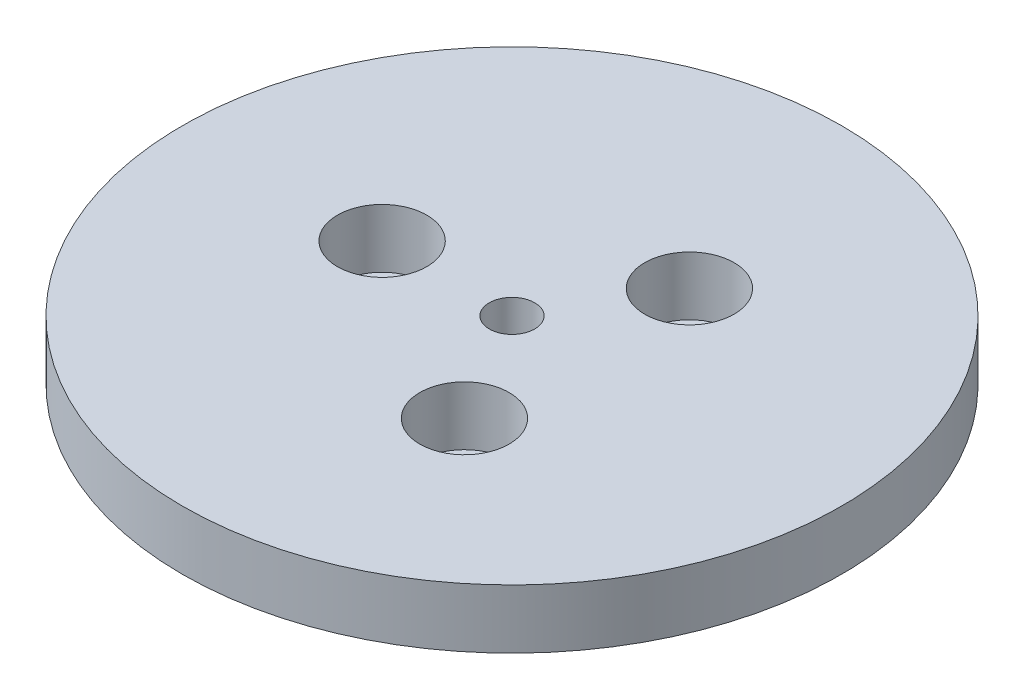
from build123d import *

# Parameters (mm, degrees)
SKETCH1_R           = 72.5
BOSS_EXTRUDE1_DEPTH = 13
SKETCH2_R           = 5
CUT_EXTRUDE1_DEPTH  = 104.351342517
SKETCH3_R           = 9.830839543
CUT_EXTRUDE2_DEPTH  = 12.925796005
CIRPATTERN1_COUNT   = 3


with BuildPart() as part:
    # Sketch1 → Boss-Extrude1 (new body)
    with BuildSketch(Plane(origin=(0, 0, 0), x_dir=(1, 0, 0), z_dir=(0, 1, 0))):
        Circle(SKETCH1_R)
    extrude(amount=BOSS_EXTRUDE1_DEPTH)

    # Sketch2 → Cut-Extrude1 (cut, through all)
    with BuildSketch(Plane(origin=(0, 0, 0), x_dir=(1, 0, 0), z_dir=(0, 1, 0))):
        Circle(SKETCH2_R)
    extrude(amount=CUT_EXTRUDE1_DEPTH, mode=Mode.SUBTRACT)

    # Sketch3 → Cut-Extrude2 (cut)
    with BuildSketch(Plane(origin=(0, 13, 0), x_dir=(1, 0, 0), z_dir=(0, 1, 0))):
        with Locations((-28.57306806, 0)):
            Circle(SKETCH3_R)
    cut_extrude2 = extrude(amount=-CUT_EXTRUDE2_DEPTH, mode=Mode.SUBTRACT)

    # CirPattern1: Cut-Extrude2 ×3 about axis
    cirpattern1_axis = Axis((0, 0, 0), (0, 1, 0))
    for i in range(1, CIRPATTERN1_COUNT):
        add(cut_extrude2.rotate(cirpattern1_axis, i * 360 / CIRPATTERN1_COUNT), mode=Mode.SUBTRACT)


solid = part.part
